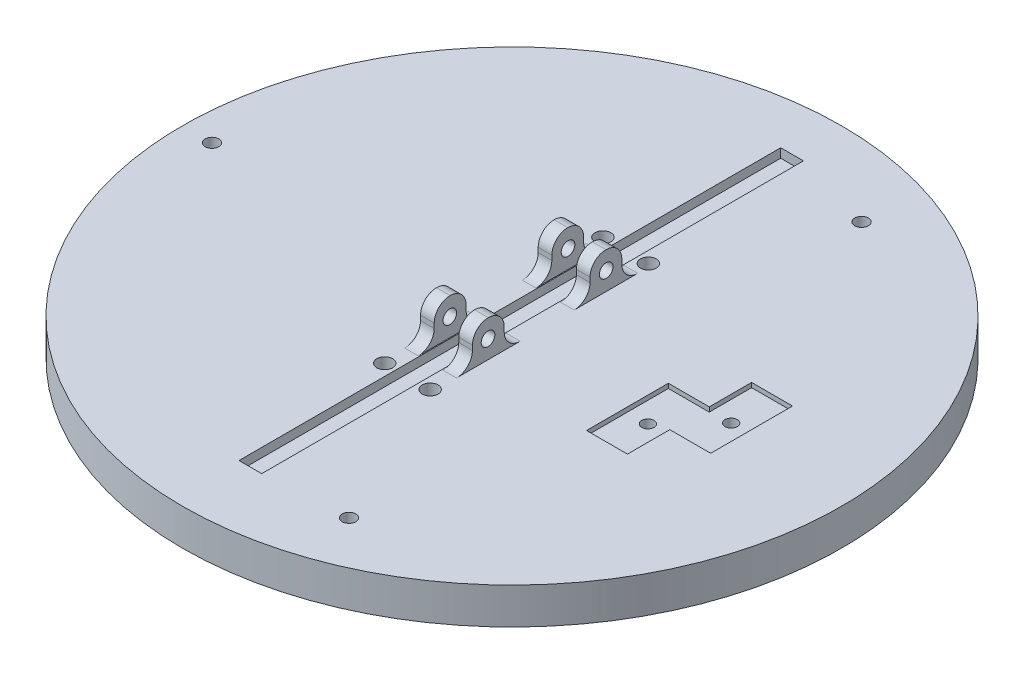
from build123d import *

# Parameters (mm, degrees)
SKETCH_1_R             = 72.5
EXTRUDE_1_DEPTH        = 8
SKETCH_4_R             = 1.75
CUT_EXTRUDE_4_DEPTH    = 10
CUT_EXTRUDE_2_REACH    = 104.842
SKETCH_6_R             = 1.5
SKETCH_10_R            = 1.5
CUT_EXTRUDE_6_DEPTH    = 10
SKETCH_8_W             = 3
SKETCH_8_H             = 7
EXTRUDE_2_DEPTH        = 8
FILLET_1_R             = 3.5
SKETCH_9_R             = 1.5
CUT_EXTRUDE_5_DEPTH    = 106.675399219
FILLET_1_OF_MIRROR_1_R = 3.5
MIRROR_START           = -5.7
MIRROR_2_OUTLINE_R     = 1.5
MIRROR_2_DEPTH         = 3
SKETCH_11_R            = 1.35
CUT_EXTRUDE_7_DEPTH    = 103.842111997
SKETCH_12_W            = 9
SKETCH_12_H            = 18
CUT_EXTRUDE_8_DEPTH    = 1
SKETCH_7_R             = 3
CUT_EXTRUDE_3_DEPTH    = 3.5
SKETCH_14_W            = 5
SKETCH_14_H            = 1
SKETCH_14_H_2          = 117.17646446
CUT_EXTRUDE_9_DEPTH    = 2


# Read off the part's stored shape, not the designer's step: 镜向2
with BuildPart() as part:
    # 草图1 → 凸台-拉伸1 (new body)
    with BuildSketch(Plane(origin=(0, 0, 0), x_dir=(1, 0, 0), z_dir=(0, 1, 0))):
        with Locations(Location((0, 0, 0), (0, 0, 270))):
            Circle(SKETCH_1_R)
    extrude(amount=EXTRUDE_1_DEPTH)

    # 草图4 → 切除-拉伸4 (cut)
    with BuildSketch(Plane(origin=(0, 8, 0), x_dir=(1, 0, 0), z_dir=(0, 1, 0))):
        with Locations(Location((-5, -23, 0), (0, 0, 270))):
            Circle(SKETCH_4_R)
        with Locations(Location((-5, 25, 0), (0, 0, 270))):
            Circle(SKETCH_4_R)
        with Locations(Location((5, 25, 0), (0, 0, 270))):
            Circle(SKETCH_4_R)
        with Locations(Location((5, -23, 0), (0, 0, 270))):
            Circle(SKETCH_4_R)
    extrude(amount=-CUT_EXTRUDE_4_DEPTH, mode=Mode.SUBTRACT)

    # 草图6 → 切除-拉伸2 (cut, up to next)
    with BuildSketch(Plane(origin=(0, 8, 0), x_dir=(1, 0, 0), z_dir=(0, 1, 0)), mode=Mode.PRIVATE) as cut_extrude_2_sk1:
        with Locations(Location((20.5212086, -56.381557247, 0), (0, 0, 270))):
            Circle(SKETCH_6_R)
    cut_extrude_2_tool1 = extrude(cut_extrude_2_sk1.sketch, amount=-CUT_EXTRUDE_2_REACH, mode=Mode.PRIVATE) & part.part
    # 草图6 → 切除-拉伸2 (cut, up to next)
    with BuildSketch(Plane(origin=(0, 8, 0), x_dir=(1, 0, 0), z_dir=(0, 1, 0)), mode=Mode.PRIVATE) as cut_extrude_2_sk2:
        with Locations(Location((20.5212086, 56.381557247, 0), (0, 0, 270))):
            Circle(SKETCH_6_R)
    cut_extrude_2_tool2 = extrude(cut_extrude_2_sk2.sketch, amount=-CUT_EXTRUDE_2_REACH, mode=Mode.PRIVATE) & part.part
    add(cut_extrude_2_tool1.solids().sort_by_distance((20.521209, 8, 56.381557))[0], mode=Mode.SUBTRACT)
    add(cut_extrude_2_tool2.solids().sort_by_distance((20.521209, 8, -56.381557))[0], mode=Mode.SUBTRACT)

    # 草图10 → 切除-拉伸6 (cut)
    with BuildSketch(Plane(origin=(0, 8, 0), x_dir=(1, 0, 0), z_dir=(0, 1, 0))):
        with Locations(Location((-66, 0, 0), (0, 0, 270))):
            Circle(SKETCH_10_R)
    extrude(amount=-CUT_EXTRUDE_6_DEPTH, mode=Mode.SUBTRACT)

    # 草图8 → 凸台-拉伸2 (add)
    with BuildSketch(Plane(origin=(0, 8, 0), x_dir=(1, 0, 0), z_dir=(0, 1, 0))):
        with Locations((4.2, -10.911845751)):
            Rectangle(SKETCH_8_W, SKETCH_8_H)
    extrude_2 = extrude(amount=EXTRUDE_2_DEPTH)

    # 圆角1
    fillet_1_edges = [part.edges().sort_by_distance(p)[0] for p in [
        (4.2, 8, 7.411845751),
        (4.2, 8, 14.411845751),
    ]]
    fillet(fillet_1_edges, radius=FILLET_1_R)
    fillet_1_2_edges = [part.edges().sort_by_distance(p)[0] for p in [
        (4.2, 16, 7.411845751),
        (4.2, 16, 14.411845751),
    ]]
    fillet(fillet_1_2_edges, radius=FILLET_1_R - 0.0001)  # a hair under: the kernel refuses the full size

    # 草图9 → 切除-拉伸5 (cut, through all)
    with BuildSketch(Plane(origin=(2.7, 0, 0), x_dir=(0, 0, -1), z_dir=(1, 0, 0))):
        with Locations(Location((-10.975, 12, 0), (0, 0, 180))):
            Circle(SKETCH_9_R)
    cut_extrude_5 = extrude(amount=CUT_EXTRUDE_5_DEPTH, mode=Mode.SUBTRACT)

    # 镜向1: 凸台-拉伸2, 切除-拉伸5 across plane
    add(extrude_2.mirror(Plane.XY.offset(-2.025)))
    add(cut_extrude_5.mirror(Plane.XY.offset(-2.025)), mode=Mode.SUBTRACT)

    # 圆角1 of 镜向1
    fillet_1_of_mirror_1_edges = [part.edges().sort_by_distance(p)[0] for p in [
        (4.2, 8, -11.461845751),
        (4.2, 8, -18.461845751),
    ]]
    fillet(fillet_1_of_mirror_1_edges, radius=FILLET_1_OF_MIRROR_1_R)
    fillet_1_of_mirror_1_2_edges = [part.edges().sort_by_distance(p)[0] for p in [
        (4.2, 16, -11.461845751),
        (4.2, 16, -18.461845751),
    ]]
    fillet(fillet_1_of_mirror_1_2_edges, radius=FILLET_1_OF_MIRROR_1_R - 0.0001)  # a hair under: the kernel refuses the full size

    # 镜向2 outline → 镜向2 (add)
    # profile 1 of 2: a face of its own
    with BuildSketch(Plane.YZ.offset(MIRROR_START)):
        with BuildLine():
            ThreePointArc((11.5, -11.461845751), (9.025126266, -10.436719485), (8, -7.961845751))
            Line((8, -7.961845751), (8, -21.961845751))
            ThreePointArc((8, -21.961845751), (9.025126266, -19.486972017), (11.5, -18.461845751))
            Line((11.5, -18.461845751), (12.5, -18.461845751))
            ThreePointArc((12.5, -18.461845751), (14.974873734, -17.436719485), (16, -14.961845751))
            ThreePointArc((16, -14.961845751), (14.974873734, -12.486972017), (12.5, -11.461845751))
            Line((12.5, -11.461845751), (11.5, -11.461845751))
        make_face()
        with Locations((12, -15.025)):
            Circle(MIRROR_2_OUTLINE_R, mode=Mode.SUBTRACT)
    # profile 2 of 2: a face of its own
    with BuildSketch(Plane.YZ.offset(MIRROR_START)):
        with BuildLine():
            Line((12.5, 14.411845751), (11.5, 14.411845751))
            ThreePointArc((11.5, 14.411845751), (9.025126266, 15.436972017), (8, 17.911845751))
            Line((8, 17.911845751), (8, 3.911845751))
            ThreePointArc((8, 3.911845751), (9.025126266, 6.386719485), (11.5, 7.411845751))
            Line((11.5, 7.411845751), (12.5, 7.411845751))
            ThreePointArc((12.5, 7.411845751), (14.974873734, 8.436972017), (16, 10.911845751))
            ThreePointArc((16, 10.911845751), (14.974873734, 13.386719485), (12.5, 14.411845751))
        make_face()
        with Locations((12, 10.975)):
            Circle(MIRROR_2_OUTLINE_R, mode=Mode.SUBTRACT)
    extrude(amount=MIRROR_2_DEPTH)

    # 草图11 → 切除-拉伸7 (cut, through all)
    with BuildSketch(Plane(origin=(0, 8, 0), x_dir=(1, 0, 0), z_dir=(0, 1, 0))):
        with Locations(Location((34.508854567, -4.60948011, 0), (0, 0, 270))):
            Circle(SKETCH_11_R)
        with Locations(Location((43.508854567, 4.7, 0), (0, 0, 270))):
            Circle(SKETCH_11_R)
    extrude(amount=-CUT_EXTRUDE_7_DEPTH, mode=Mode.SUBTRACT)

    # 草图12 → 切除-拉伸8 (cut)
    with BuildSketch(Plane(origin=(0, 8, 0), x_dir=(1, 0, 0), z_dir=(0, 1, 0))):
        with Locations((43.508854567, 4.7)):
            Rectangle(SKETCH_12_W, SKETCH_12_H)
        with Locations((34.508854567, -4.60948011)):
            Rectangle(SKETCH_12_W, SKETCH_12_H)
    extrude(amount=-CUT_EXTRUDE_8_DEPTH, mode=Mode.SUBTRACT)

    # 草图7 → 切除-拉伸3 (cut)
    with BuildSketch(Plane.XZ):
        with Locations(Location((20.5212086, 56.381557247, 0), (0, 0, 270))):
            Circle(SKETCH_7_R)
        with Locations(Location((20.5212086, -56.381557247, 0), (0, 0, 270))):
            Circle(SKETCH_7_R)
        with Locations(Location((-5, 23, 0), (0, 0, 270))):
            Circle(SKETCH_7_R)
        with Locations(Location((5, 23, 0), (0, 0, 270))):
            Circle(SKETCH_7_R)
        with Locations(Location((5, -25, 0), (0, 0, 270))):
            Circle(SKETCH_7_R)
        with Locations(Location((-5, -25, 0), (0, 0, 270))):
            Circle(SKETCH_7_R)
        with Locations(Location((-66, 0, 0), (0, 0, 270))):
            Circle(SKETCH_7_R)
        with Locations(Location((43.508854567, -4.7, 0), (0, 0, 270))):
            Circle(SKETCH_7_R)
        with Locations(Location((34.508854567, 4.60948011, 0), (0, 0, 270))):
            Circle(SKETCH_7_R)
    extrude(amount=-CUT_EXTRUDE_3_DEPTH, mode=Mode.SUBTRACT)

    # 草图14 → 切除-拉伸9 (cut)
    with BuildSketch(Plane(origin=(0, 8, 0), x_dir=(1, 0, 0), z_dir=(0, 1, 0))):
        with Locations((0, 61.11323223)):
            Rectangle(SKETCH_14_W, SKETCH_14_H)
        with Locations((0, 2.025)):
            Rectangle(SKETCH_14_W, SKETCH_14_H_2)
        with Locations((0, -57.06323223)):
            Rectangle(SKETCH_14_W, SKETCH_14_H)
    extrude(amount=-CUT_EXTRUDE_9_DEPTH, mode=Mode.SUBTRACT)


solid = part.part
